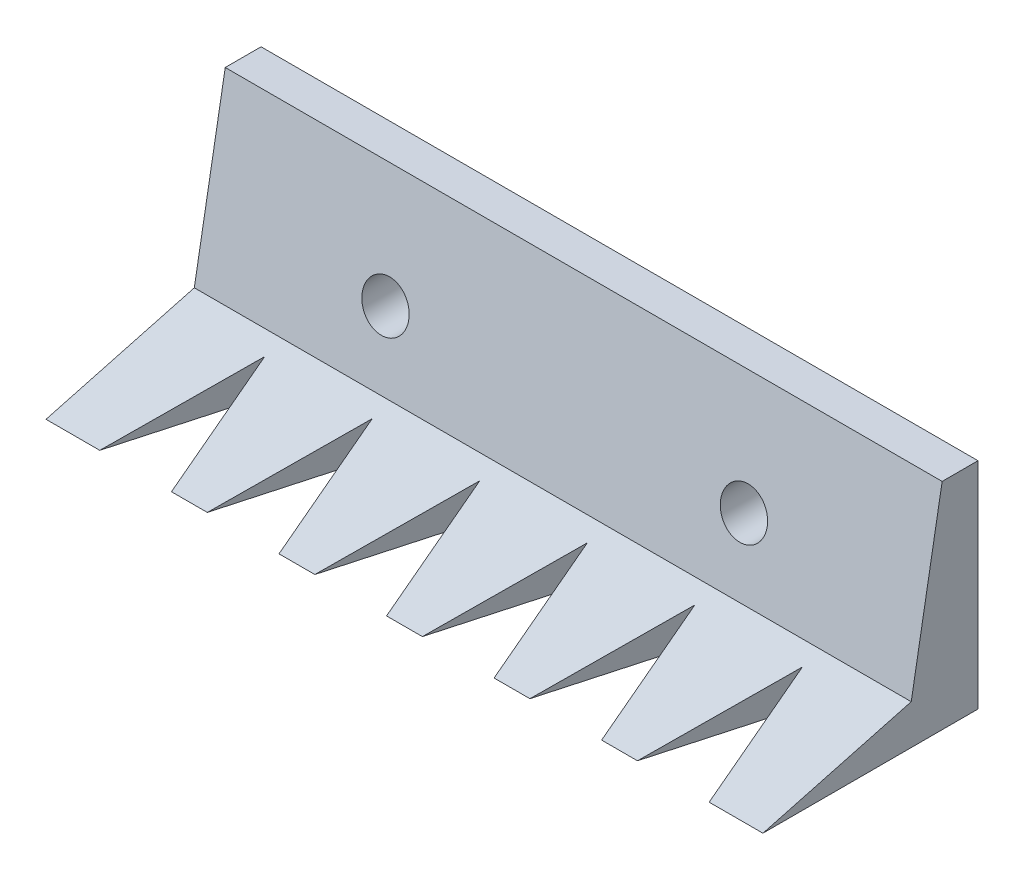
from build123d import *

# Parameters (mm, degrees)
BOSS_EXTRUDE1_DEPTH  = 100
M3_CLEARANCE_HOLE1_D = 3.4
SKETCH4_R            = 3.25
CUT_EXTRUDE1_DEPTH   = 108.964114408
CUT_EXTRUDE2_DEPTH   = 109.627804912
LPATTERN1_COUNT      = 6
LPATTERN1_PITCH      = 15


with BuildPart() as part:
    # Sketch1 → Boss-Extrude1 (new body)
    with BuildSketch(Plane(origin=(0, 0, 0), x_dir=(0, 0, -1), z_dir=(1, 0, 0))):
        Polygon((0, 0), (0, 30), (-5, 30), (-9.312388631, 5.54322876), (-30, 0), align=None)
    extrude(amount=BOSS_EXTRUDE1_DEPTH)

    # M3 Clearance Hole1 (through all)
    with Locations(Plane(origin=(0, 0, 0), x_dir=(-1, 0, 0), z_dir=(0, 0, -1))):
        with Locations((-25, 15), (-75, 15)):
            Hole(M3_CLEARANCE_HOLE1_D / 2)

    # Sketch4 → Cut-Extrude1 (cut, through all)
    with BuildSketch(Plane(origin=(0, 0, 2.5), x_dir=(-1, 0, 0), z_dir=(0, 0, -1))):
        with Locations((-75, 15)):
            Circle(SKETCH4_R)
        with Locations((-25, 15)):
            Circle(SKETCH4_R)
    extrude(amount=-CUT_EXTRUDE1_DEPTH, mode=Mode.SUBTRACT)

    # Sketch5 → Cut-Extrude2 (cut, symmetric)
    with BuildSketch(Plane(origin=(0, 0, 0), x_dir=(1, 0, 0), z_dir=(0, 1, 0))):
        Polygon((7.5, -30), (12.5, -12), (17.5, -30), align=None)
    cut_extrude2 = extrude(amount=CUT_EXTRUDE2_DEPTH, both=True, mode=Mode.SUBTRACT)

    # LPattern1: Cut-Extrude2 ×6
    with Locations(*[(i * LPATTERN1_PITCH, 0, 0) for i in range(1, LPATTERN1_COUNT)]):
        add(cut_extrude2, mode=Mode.SUBTRACT)


solid = part.part
